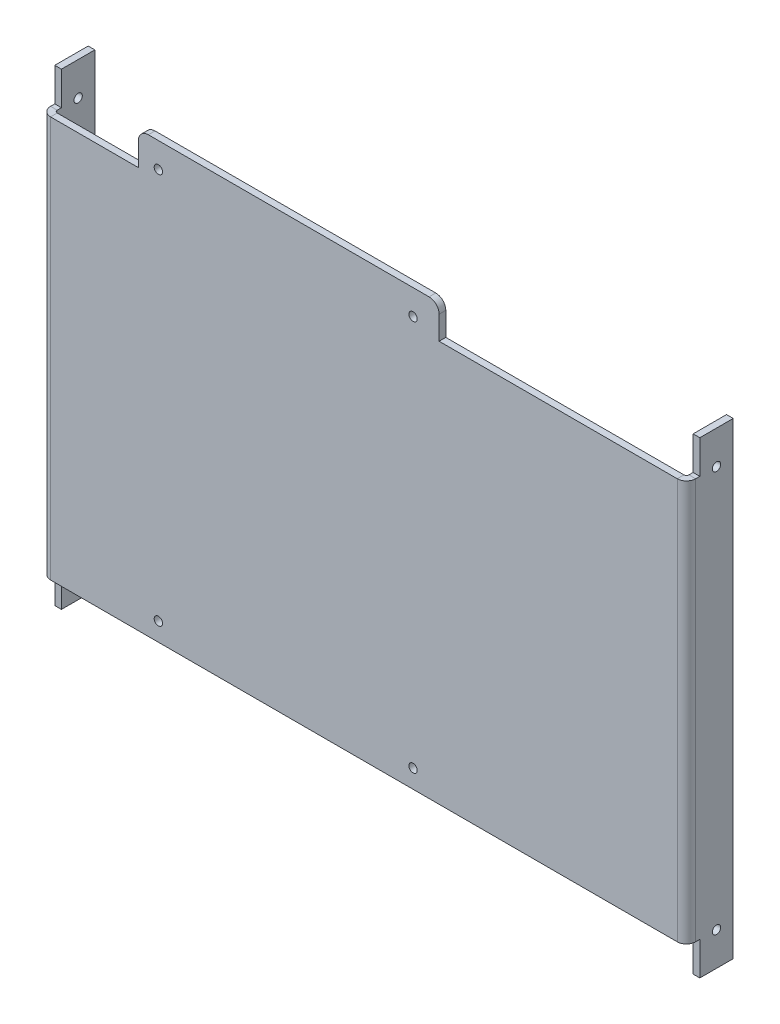
from build123d import *

# Parameters (mm, degrees)
SKETCH_3_W                         = 193
SKETCH_3_H                         = 140
SM_BASE_FLANGE_1_DEPTH             = 2
SM_EDGE_FLANGE_1_STRIP_W           = 9.4732
SM_EDGE_FLANGE_1_STRIP_H           = 2
SM_EDGE_FLANGE_1_STRIP_CUT_DEPTH   = 140
SM_EDGE_FLANGE_1_STRIP_2_W         = 9.4732
SM_EDGE_FLANGE_1_STRIP_2_H         = 2
SM_EDGE_FLANGE_1_STRIP_CUT_2_DEPTH = 140
SM_EDGE_FLANGE_1_DEPTH             = 140
SM_EDGE_FLANGE_1_BEND_DEPTH        = 140
HOLE_WIZARD_M3_2_D                 = 2.5
HOLE_WIZARD_M3_3_D                 = 2.5
HOLE_WIZARD_M3_3_DEPTH             = 2
HOLE_WIZARD_M3_4_D                 = 2.5
SKETCH_23_W                        = 185
SKETCH_23_H                        = 10
SKETCH_23_W_2                      = 25
SKETCH_23_W_3                      = 70
CUT_EXTRUDE_1_DEPTH                = 10
FILLET_1_R                         = 3
SKETCH_24_W                        = 4
SKETCH_24_H                        = 10
CUT_EXTRUDE_2_DEPTH                = 239.840951263
SKETCH_25_W                        = 4
SKETCH_25_H                        = 10
CUT_EXTRUDE_3_DEPTH                = 10
SKETCH_26_W                        = 4
SKETCH_26_H                        = 10
CUT_EXTRUDE_4_DEPTH                = 10


# Sheet-metal steps are written as plain solids
with BuildPart() as part:
    # ｽｹｯﾁ3 → ﾍﾞｰｽ-ﾌﾗﾝｼﾞ1 (new body)
    with BuildSketch(Plane.XY):
        with Locations((96.5, 70)):
            Rectangle(SKETCH_3_W, SKETCH_3_H)
    extrude(amount=-SM_BASE_FLANGE_1_DEPTH)

    # ｴｯｼﾞ-ﾌﾗﾝｼﾞ1 strip (across the edge) → ｴｯｼﾞ-ﾌﾗﾝｼﾞ1 strip cut (cut)
    with BuildSketch(Plane(origin=(0, 0, -2), x_dir=(1, 0, 0), z_dir=(0, 1, 0))):
        with Locations((-2, -1)):
            Rectangle(SM_EDGE_FLANGE_1_STRIP_W, SM_EDGE_FLANGE_1_STRIP_H)
    extrude(amount=SM_EDGE_FLANGE_1_STRIP_CUT_DEPTH, mode=Mode.SUBTRACT)

    # ｴｯｼﾞ-ﾌﾗﾝｼﾞ1 strip 2 (across the edge) → ｴｯｼﾞ-ﾌﾗﾝｼﾞ1 strip cut 2 (cut)
    with BuildSketch(Plane(origin=(193, 140, -2), x_dir=(-1, 0, 0), z_dir=(0, -1, 0))):
        with Locations((-2, -1)):
            Rectangle(SM_EDGE_FLANGE_1_STRIP_2_W, SM_EDGE_FLANGE_1_STRIP_2_H)
    extrude(amount=SM_EDGE_FLANGE_1_STRIP_CUT_2_DEPTH, mode=Mode.SUBTRACT)

    # ｴｯｼﾞ-ﾌﾗﾝｼﾞ1 section (across the edge) → ｴｯｼﾞ-ﾌﾗﾝｼﾞ1 (add)
    with BuildSketch(Plane(origin=(0, 0, -2), x_dir=(1, 0, 0), z_dir=(0, 1, 0))):
        with BuildLine():
            Line((0, 0.7366), (0, 12))
            Line((0, 12), (2, 12))
            Line((2, 12), (2, 0.7366))
            ThreePointArc((2, 0.7366), (2.215745145, 0.215745145), (2.7366, 0))
            Line((2.7366, 0), (2.7366, -2))
            ThreePointArc((2.7366, -2), (0.801531583, -1.198468417), (0, 0.7366))
        make_face()
    extrude(amount=SM_EDGE_FLANGE_1_DEPTH)

    # ｴｯｼﾞ-ﾌﾗﾝｼﾞ1 section 2 (across the edge) → ｴｯｼﾞ-ﾌﾗﾝｼﾞ1 bend (add)
    with BuildSketch(Plane(origin=(193, 140, -2), x_dir=(-1, 0, 0), z_dir=(0, -1, 0))):
        with BuildLine():
            Line((0, 0.7366), (0, 12))
            Line((0, 12), (2, 12))
            Line((2, 12), (2, 0.7366))
            ThreePointArc((2, 0.7366), (2.215745145, 0.215745145), (2.7366, 0))
            Line((2.7366, 0), (2.7366, -2))
            ThreePointArc((2.7366, -2), (0.801531583, -1.198468417), (0, 0.7366))
        make_face()
    extrude(amount=SM_EDGE_FLANGE_1_BEND_DEPTH)

    # M3 ねじ穴2 (through all)
    with Locations(Plane.XY):
        with Locations((35, 132.5), (35, 15.5), (111.2, 15.5), (111.2, 132.5)):
            Hole(HOLE_WIZARD_M3_2_D / 2)

    # M3 ねじ穴3
    with Locations(Plane.ZY):
        with Locations((-9, 130), (-9, 10)):
            Hole(HOLE_WIZARD_M3_3_D / 2, depth=HOLE_WIZARD_M3_3_DEPTH)

    # M3 ねじ穴4 (through all)
    with Locations(Plane(origin=(193, 0, 0), x_dir=(0, 0, -1), z_dir=(1, 0, 0))):
        with Locations((9, 130), (9, 10)):
            Hole(HOLE_WIZARD_M3_4_D / 2)

    # ｽｹｯﾁ23 → ｶｯﾄ - 押し出し1 (cut)
    with BuildSketch(Plane.XY):
        with Locations((96.5, 5)):
            Rectangle(SKETCH_23_W, SKETCH_23_H)
        with Locations((16.5, 135)):
            Rectangle(SKETCH_23_W_2, SKETCH_23_H)
        with Locations((154, 135)):
            Rectangle(SKETCH_23_W_3, SKETCH_23_H)
    extrude(amount=-CUT_EXTRUDE_1_DEPTH, mode=Mode.SUBTRACT)

    # ﾌｨﾚｯﾄ1
    fillet_1_edges = [part.edges().sort_by_distance(p)[0] for p in [
        (29, 140, -1),
        (119, 140, -1),
    ]]
    fillet(fillet_1_edges, radius=FILLET_1_R)

    # ｽｹｯﾁ24 → ｶｯﾄ - 押し出し2 (cut, through all)
    with BuildSketch(Plane.ZY):
        with Locations((-2, 5)):
            Rectangle(SKETCH_24_W, SKETCH_24_H)
    extrude(amount=-CUT_EXTRUDE_2_DEPTH, mode=Mode.SUBTRACT)

    # ｽｹｯﾁ25 → ｶｯﾄ - 押し出し3 (cut)
    with BuildSketch(Plane.ZY):
        with Locations((-2, 135)):
            Rectangle(SKETCH_25_W, SKETCH_25_H)
    extrude(amount=-CUT_EXTRUDE_3_DEPTH, mode=Mode.SUBTRACT)

    # ｽｹｯﾁ26 → ｶｯﾄ - 押し出し4 (cut)
    with BuildSketch(Plane(origin=(193, 0, 0), x_dir=(0, 0, -1), z_dir=(1, 0, 0))):
        with Locations((2, 135)):
            Rectangle(SKETCH_26_W, SKETCH_26_H)
    extrude(amount=-CUT_EXTRUDE_4_DEPTH, mode=Mode.SUBTRACT)


solid = part.part
